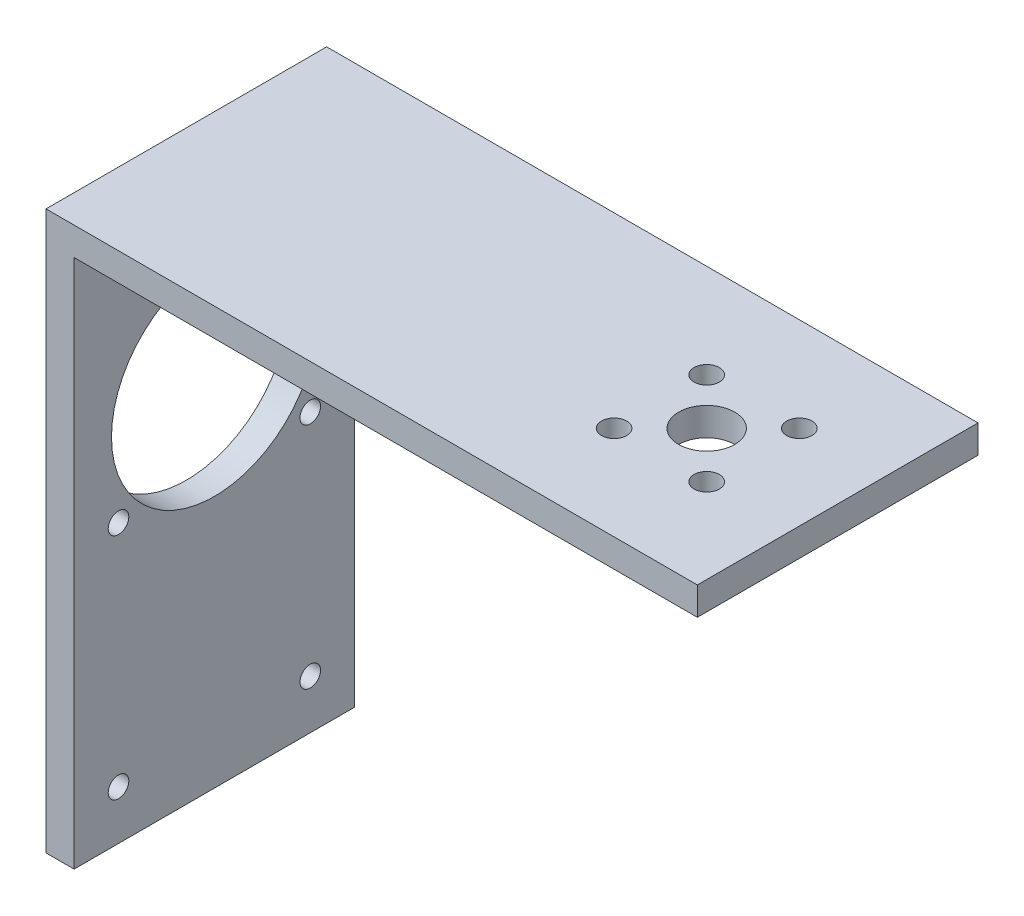
from build123d import *

# Parameters (mm, degrees)
S_BOX1_W      = 69.625
S_BOX1_H      = 3
BOSS_1_DEPTH  = 30
S_BOX2_W      = 3
S_BOX2_H      = 57.125
BOSS_2_DEPTH  = 30
S_BOX3_W      = 29.125
S_BOX3_H      = 3.5
BOSS_3_DEPTH  = 3
S_HOLE4_R     = 3
HOLE_4_DEPTH  = 3.2
S_HOLE5_R     = 1.35
HOLE_5_DEPTH  = 3.2
S_HOLE6_R     = 1.35
HOLE_6_DEPTH  = 3.2
S_HOLE7_R     = 1.35
HOLE_7_DEPTH  = 3.2
S_HOLE8_R     = 1.35
HOLE_8_DEPTH  = 3.2
S_HOLE9_R     = 11
HOLE_9_DEPTH  = 3.2
S_HOLE10_R    = 1.1
HOLE_10_DEPTH = 3.2
S_HOLE11_R    = 1.1
HOLE_11_DEPTH = 3.2
S_HOLE12_R    = 1.1
HOLE_12_DEPTH = 3.2
S_HOLE13_R    = 1.1
HOLE_13_DEPTH = 3.2


with BuildPart() as part:
    # S_box1 → Boss_1 (new body)
    with BuildSketch(Plane.XY.offset(-15)):
        with Locations((-20.8125, 20.125)):
            Rectangle(S_BOX1_W, S_BOX1_H)
    extrude(amount=BOSS_1_DEPTH)

    # S_box2 → Boss_2 (add)
    with BuildSketch(Plane.XY.offset(-15)):
        with Locations((-54.125, -9.4375)):
            Rectangle(S_BOX2_W, S_BOX2_H)
    extrude(amount=BOSS_2_DEPTH)

    # S_box3 → Boss_3 (add)
    with BuildSketch(Plane.XY.offset(-15)):
        with Locations((-38.5625, 17.375)):
            Rectangle(S_BOX3_W, S_BOX3_H)
    extrude(amount=BOSS_3_DEPTH)

    # S_hole4 → Hole_4 (cut)
    with BuildSketch(Plane(origin=(0, 18.525, 0), x_dir=(1, 0, 0), z_dir=(0, 1, 0))):
        Circle(S_HOLE4_R)
    extrude(amount=HOLE_4_DEPTH, mode=Mode.SUBTRACT)

    # S_hole5 → Hole_5 (cut)
    with BuildSketch(Plane(origin=(0, 18.525, 0), x_dir=(1, 0, 0), z_dir=(0, 1, 0))):
        with Locations((4.949747468, -4.949747468)):
            Circle(S_HOLE5_R)
    extrude(amount=HOLE_5_DEPTH, mode=Mode.SUBTRACT)

    # S_hole6 → Hole_6 (cut)
    with BuildSketch(Plane(origin=(0, 18.525, 0), x_dir=(1, 0, 0), z_dir=(0, 1, 0))):
        with Locations((-4.949747468, -4.949747468)):
            Circle(S_HOLE6_R)
    extrude(amount=HOLE_6_DEPTH, mode=Mode.SUBTRACT)

    # S_hole7 → Hole_7 (cut)
    with BuildSketch(Plane(origin=(0, 18.525, 0), x_dir=(1, 0, 0), z_dir=(0, 1, 0))):
        with Locations((-4.949747468, 4.949747468)):
            Circle(S_HOLE7_R)
    extrude(amount=HOLE_7_DEPTH, mode=Mode.SUBTRACT)

    # S_hole8 → Hole_8 (cut)
    with BuildSketch(Plane(origin=(0, 18.525, 0), x_dir=(1, 0, 0), z_dir=(0, 1, 0))):
        with Locations((4.949747468, 4.949747468)):
            Circle(S_HOLE8_R)
    extrude(amount=HOLE_8_DEPTH, mode=Mode.SUBTRACT)

    # S_hole9 → Hole_9 (cut)
    with BuildSketch(Plane(origin=(-55.725, 0, 0), x_dir=(0, 0, -1), z_dir=(1, 0, 0))):
        Circle(S_HOLE9_R)
    extrude(amount=HOLE_9_DEPTH, mode=Mode.SUBTRACT)

    # S_hole10 → Hole_10 (cut)
    with BuildSketch(Plane(origin=(-55.725, 0, 0), x_dir=(0, 0, -1), z_dir=(1, 0, 0))):
        with Locations((10.25, -8.3)):
            Circle(S_HOLE10_R)
    extrude(amount=HOLE_10_DEPTH, mode=Mode.SUBTRACT)

    # S_hole11 → Hole_11 (cut)
    with BuildSketch(Plane(origin=(-55.725, 0, 0), x_dir=(0, 0, -1), z_dir=(1, 0, 0))):
        with Locations((-10.25, -8.3)):
            Circle(S_HOLE11_R)
    extrude(amount=HOLE_11_DEPTH, mode=Mode.SUBTRACT)

    # S_hole12 → Hole_12 (cut)
    with BuildSketch(Plane(origin=(-55.725, 0, 0), x_dir=(0, 0, -1), z_dir=(1, 0, 0))):
        with Locations((10.25, -32.75)):
            Circle(S_HOLE12_R)
    extrude(amount=HOLE_12_DEPTH, mode=Mode.SUBTRACT)

    # S_hole13 → Hole_13 (cut)
    with BuildSketch(Plane(origin=(-55.725, 0, 0), x_dir=(0, 0, -1), z_dir=(1, 0, 0))):
        with Locations((-10.25, -32.75)):
            Circle(S_HOLE13_R)
    extrude(amount=HOLE_13_DEPTH, mode=Mode.SUBTRACT)


solid = part.part
